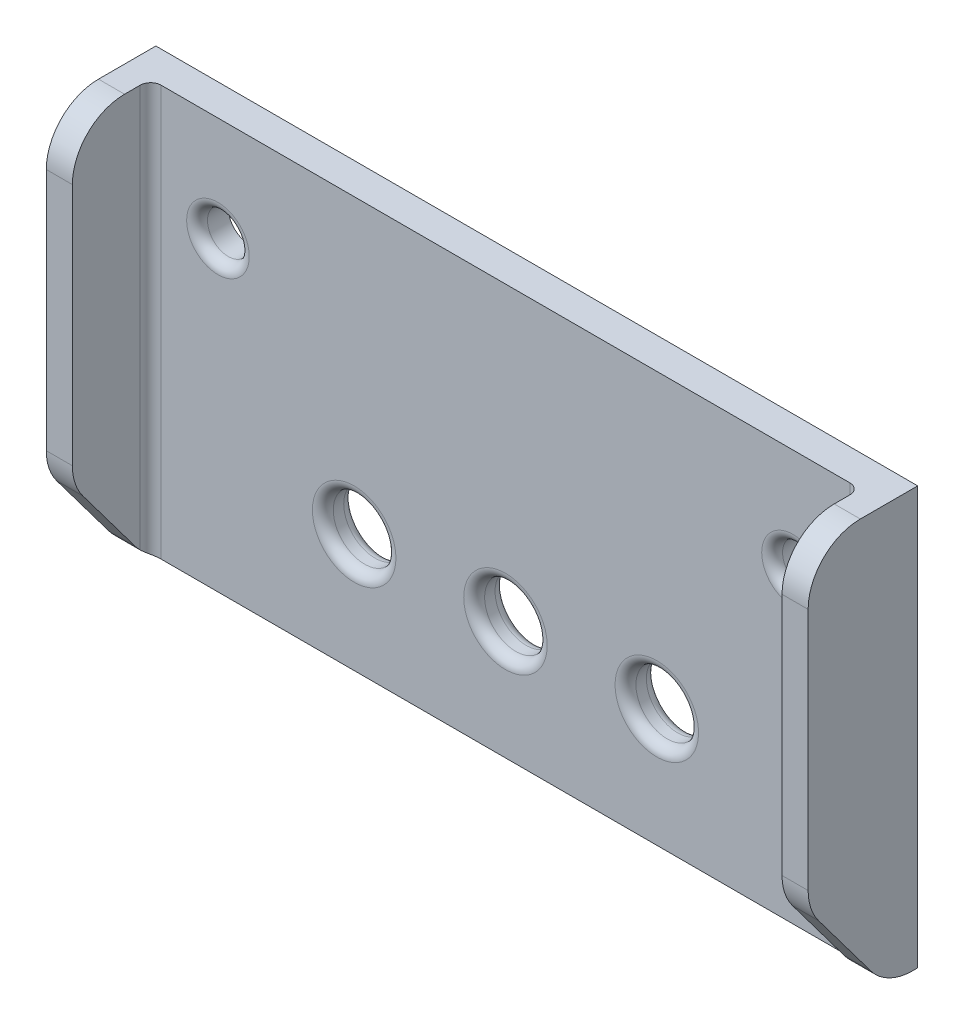
from build123d import *

# Parameters (mm, degrees)
SKETCH2_W               = 73
SKETCH2_H               = 40
BOSS_EXTRUDE1_DEPTH     = 3
SKETCH3_W               = 2.5
SKETCH3_H               = 40
BOSS_EXTRUDE2_DEPTH     = 7.5
CUT_EXTRUDE1_DEPTH      = 124
CUT_EXTRUDE1_DEPTH_BACK = 5
FILLET1_START           = -47
FILLET1_DEPTH           = 74
FILLET3_R               = 5
FILLET4_R               = 1
SKETCH5_R               = 2
SKETCH5_R_2             = 3
CUT_EXTRUDE2_DEPTH      = 5
FILLET5_R               = 1


with BuildPart() as part:
    # Sketch2 → Boss-Extrude1 (new body)
    with BuildSketch(Plane.XY):
        with Locations((-10, -9)):
            Rectangle(SKETCH2_W, SKETCH2_H)
    extrude(amount=BOSS_EXTRUDE1_DEPTH)

    # Sketch3 → Boss-Extrude2 (add)
    with BuildSketch(Plane.XY.offset(3)):
        with Locations((-45.25, -9)):
            Rectangle(SKETCH3_W, SKETCH3_H)
        with Locations((25.25, -9)):
            Rectangle(SKETCH3_W, SKETCH3_H)
    extrude(amount=BOSS_EXTRUDE2_DEPTH)

    # Sketch4 → Cut-Extrude1 (cut, two sides: drawn at the far end of the back side and taken through both)
    with BuildSketch(Plane(origin=(-44, 0, 0), x_dir=(0, 0, -1), z_dir=(1, 0, 0)).offset(-CUT_EXTRUDE1_DEPTH_BACK)):
        Polygon((-3, -29), (-10.5, -29), (-10.5, -19), align=None)
    extrude(amount=CUT_EXTRUDE1_DEPTH + CUT_EXTRUDE1_DEPTH_BACK, mode=Mode.SUBTRACT)

    # Fillet1: read off the stored shape, not the designer's step
    # Fillet1 outline → Fillet1 (cut)
    with BuildSketch(Plane.YZ.offset(FILLET1_START)):
        with BuildLine():
            Line((-29, 3), (-29, 0.5))
            ThreePointArc((-29, 0.5), (-28.472135955, 2.736067977), (-27, 4.5))
            Line((-27, 4.5), (-29, 3))
        make_face()
    extrude(amount=FILLET1_DEPTH, mode=Mode.SUBTRACT)

    # Fillet3
    fillet3_edges = [part.edges().sort_by_distance(p)[0] for p in [
        (-45.25, 11, 10.5),
        (25.25, 11, 10.5),
        (-45.25, -19, 10.5),
        (25.25, -19, 10.5),
    ]]
    fillet(fillet3_edges, radius=FILLET3_R)

    # Fillet4
    fillet4_edges = [part.edges().sort_by_distance(p)[0] for p in [
        (24, -8.665063509, 3),
        (-44, -8.665063509, 3),
    ]]
    fillet(fillet4_edges, radius=FILLET4_R)

    # Sketch5 → Cut-Extrude2 (cut)
    with BuildSketch(Plane.XY.offset(3)):
        with Locations((-37.550924627, 1)):
            Circle(SKETCH5_R)
        with Locations((17.550924627, 1)):
            Circle(SKETCH5_R)
        with Locations((4.5, -17)):
            Circle(SKETCH5_R_2)
        with Locations((-10, -17)):
            Circle(SKETCH5_R_2)
        with Locations((-24.5, -17)):
            Circle(SKETCH5_R_2)
    extrude(amount=-CUT_EXTRUDE2_DEPTH, mode=Mode.SUBTRACT)

    # Fillet5
    fillet5_edges = [part.edges().sort_by_distance(p)[0] for p in [
        (-39.550924627, 1, 3),
        (15.550924627, 1, 3),
        (1.5, -17, 0),
        (1.5, -17, 3),
        (-13, -17, 0),
        (-13, -17, 3),
        (-27.5, -17, 0),
        (-27.5, -17, 3),
    ]]
    fillet(fillet5_edges, radius=FILLET5_R)


solid = part.part
